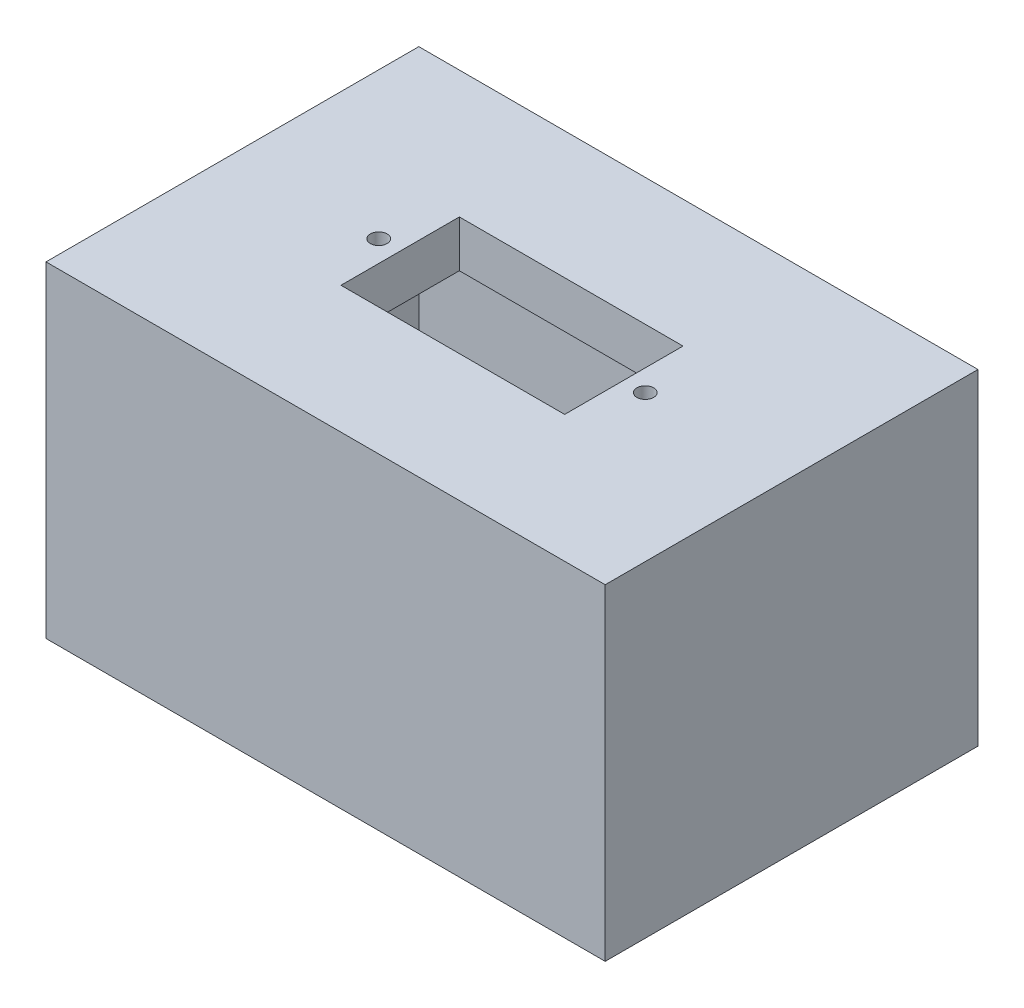
from build123d import *

# Parameters (mm, degrees)
SKETCH_1_W      = 37.106607932
SKETCH_1_H      = 19.271696716
SKETCH_1_R      = 0.9
SKETCH_1_W_2    = 24
SKETCH_1_H_2    = 12.7
EXTRUDE_1_DEPTH = 5
SKETCH_36_W     = 60
SKETCH_36_H     = 40
SKETCH_36_W_2   = 37.106607932
SKETCH_36_H_2   = 19.271696716
EXTRUDE_2_DEPTH = 5
SKETCH_45_W     = 60
SKETCH_45_H     = 40
SKETCH_45_W_2   = 54
SKETCH_45_H_2   = 34
EXTRUDE_3_DEPTH = 30


with BuildPart() as part:
    # 草图1 → 凸台-拉伸1 (new body)
    with BuildSketch(Plane(origin=(0, 0, 0), x_dir=(1, 0, 0), z_dir=(0, 1, 0))):
        Rectangle(SKETCH_1_W, SKETCH_1_H)
        with Locations((-14.3, 0)):
            Circle(SKETCH_1_R, mode=Mode.SUBTRACT)
        with Locations((14.3, 0)):
            Circle(SKETCH_1_R, mode=Mode.SUBTRACT)
        Rectangle(SKETCH_1_W_2, SKETCH_1_H_2, mode=Mode.SUBTRACT)
    extrude(amount=EXTRUDE_1_DEPTH)

    # 草图36 → 凸台-拉伸2 (add)
    with BuildSketch(Plane(origin=(0, 5, 0), x_dir=(1, 0, 0), z_dir=(0, 1, 0))):
        Rectangle(SKETCH_36_W, SKETCH_36_H)
        Rectangle(SKETCH_36_W_2, SKETCH_36_H_2, mode=Mode.SUBTRACT)
    extrude(amount=-EXTRUDE_2_DEPTH)

    # 草图45 → 凸台-拉伸3 (add)
    with BuildSketch(Plane.XZ):
        Rectangle(SKETCH_45_W, SKETCH_45_H)
        Rectangle(SKETCH_45_W_2, SKETCH_45_H_2, mode=Mode.SUBTRACT)
    extrude(amount=EXTRUDE_3_DEPTH)


solid = part.part
